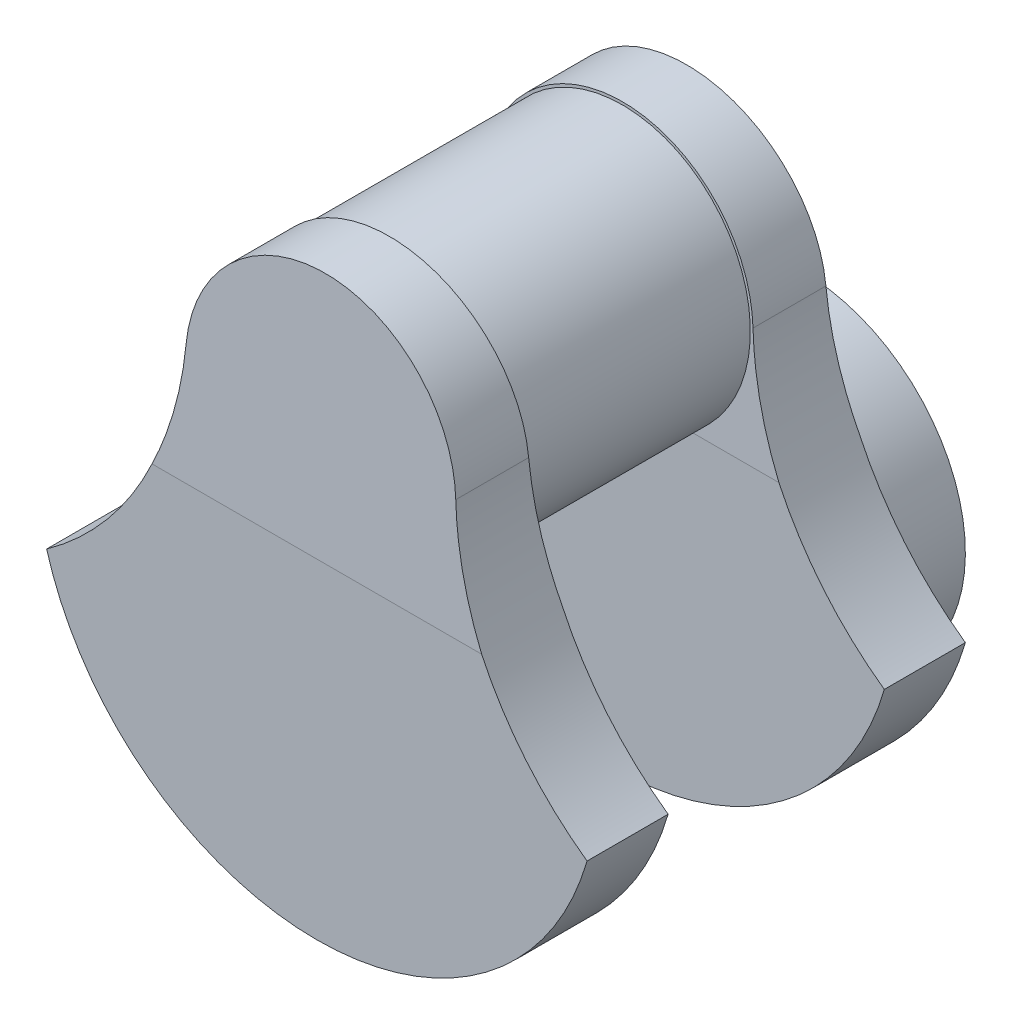
from build123d import *
from build123d.topology import SkipClean

# Parameters (mm, degrees)
BOSS_EXTRUDE1_DEPTH   = 7.5
CUT_EXTRUDE1_DEPTH    = 90.620722002
SKETCH4_R             = 24.5
BOSS_EXTRUDE3_DEPTH   = 50
LPATTERN6_START       = -60.928565373
LPATTERN6_DEPTH       = 11.857130746
LPATTERN6_START_2     = -62.5
LPATTERN6_2_OUTLINE_R = 24.5
LPATTERN6_2_DEPTH     = 15
LPATTERN6_3_OUTLINE_R = 24.5
LPATTERN6_3_DEPTH     = 1.571434627
LPATTERN6_START_3     = -49.996237981
LPATTERN6_4_DEPTH     = 99.992475962
BOSS_EXTRUDE5_DEPTH   = 10
SKETCH8_R             = 30
BOSS_EXTRUDE7_DEPTH   = 20


with BuildPart() as part:
    # Sketch1 → Boss-Extrude1 (new, symmetric)
    with BuildSketch(Plane.XY):
        with BuildLine():
            ThreePointArc((-24.948290112, 50.607115575), (0, 74), (24.948290112, 50.607115575))
            ThreePointArc((24.948290112, 50.607115575), (32.398481343, 25.282941249), (49.996237981, 5.607115575))
            ThreePointArc((49.996237981, 5.607115575), (0, -32.02671366), (-49.996237981, 5.607115575))
            ThreePointArc((-49.996237981, 5.607115575), (-32.398481343, 25.282941249), (-24.948290112, 50.607115575))
        make_face()
    extrude(amount=BOSS_EXTRUDE1_DEPTH, both=True)

    # Sketch2 → Cut-Extrude1 (cut, symmetric)
    with BuildSketch(Plane(origin=(0, 0, 0), x_dir=(0, 0, -1), z_dir=(1, 0, 0))):
        Polygon((-7.5, 29), (-5.928565373, 74), (-7.5, 74), align=None)
        Polygon((7.5, 74), (7.5, 29), (5.928565373, 74), align=None)
    extrude(amount=CUT_EXTRUDE1_DEPTH, both=True, mode=Mode.SUBTRACT)

    # Sketch4 → Boss-Extrude3 (add)
    with BuildSketch(Plane.XY):
        with Locations((0, 49)):
            Circle(SKETCH4_R)
    extrude(amount=-BOSS_EXTRUDE3_DEPTH)

    # LPattern6: read off the stored shape, not the designer's step
    # LPattern6 outline → LPattern6 (add)
    with BuildSketch(Plane.XY.offset(LPATTERN6_START)):
        with BuildLine():
            ThreePointArc((-49.996237981, 5.607115575), (0, -32.02671366), (49.996237981, 5.607115575))
            ThreePointArc((49.996237981, 5.607115575), (32.398481343, 25.282941249), (24.948290112, 50.607115575))
            ThreePointArc((24.948290112, 50.607115575), (0, 74), (-24.948290112, 50.607115575))
            ThreePointArc((-24.948290112, 50.607115575), (-32.398481343, 25.282941249), (-49.996237981, 5.607115575))
        make_face()
    extrude(amount=LPATTERN6_DEPTH)

    # LPattern6 2 outline → LPattern6 2 (add)
    with BuildSketch(Plane.XY.offset(LPATTERN6_START_2)):
        with BuildLine():
            ThreePointArc((-49.996237981, 5.607115575), (0, -32.02671366), (49.996237981, 5.607115575))
            ThreePointArc((49.996237981, 5.607115575), (32.398481343, 25.282941249), (24.948290112, 50.607115575))
            ThreePointArc((24.948290112, 50.607115575), (0, 74), (-24.948290112, 50.607115575))
            ThreePointArc((-24.948290112, 50.607115575), (-32.398481343, 25.282941249), (-49.996237981, 5.607115575))
        make_face()
        with Locations((0, 49)):
            Circle(LPATTERN6_2_OUTLINE_R, mode=Mode.SUBTRACT)
    extrude(amount=LPATTERN6_2_DEPTH)

    # LPattern6 3 outline → LPattern6 3 (add)
    with BuildSketch(Plane.XY.offset(LPATTERN6_START_2)):
        with Locations((0, 49)):
            Circle(LPATTERN6_3_OUTLINE_R)
    extrude(amount=LPATTERN6_3_DEPTH)

    # LPattern6 4 outline → LPattern6 4 (cut)
    with BuildSketch(Plane.YZ.offset(LPATTERN6_START_3)):
        Polygon((75, -60.893644604), (74, -60.928565373), (29, -62.5), (75, -62.5), align=None)
        Polygon((74, -49.071434627), (75, -49.106355396), (75, -47.5), (29, -47.5), align=None)
    extrude(amount=LPATTERN6_4_DEPTH, mode=Mode.SUBTRACT)

    # Sketch5 → Boss-Extrude5 (add)
    with SkipClean():  # the faces are left unmerged after this step: merging them gives an invalid solid
        with BuildSketch(Plane(origin=(0, 0, -47.5), x_dir=(-1, 0, 0), z_dir=(0, 0, -1))):
            with BuildLine():
                Line((-14.150971698, 29), (14.150971698, 29))
                ThreePointArc((14.150971698, 29), (0, 73.5), (-14.150971698, 29))
            make_face()
        extrude(amount=BOSS_EXTRUDE5_DEPTH)

    # Sketch8 → Boss-Extrude7 (add)
    with SkipClean():  # the faces are left unmerged after this step: merging them gives an invalid solid
        with BuildSketch(Plane(origin=(0, 0, -62.5), x_dir=(-1, 0, 0), z_dir=(0, 0, -1))):
            with Locations(Location((0, 0, 0), (0, 0, 104.835111582))):
                Circle(SKETCH8_R)
        extrude(amount=BOSS_EXTRUDE7_DEPTH)


solid = part.part
